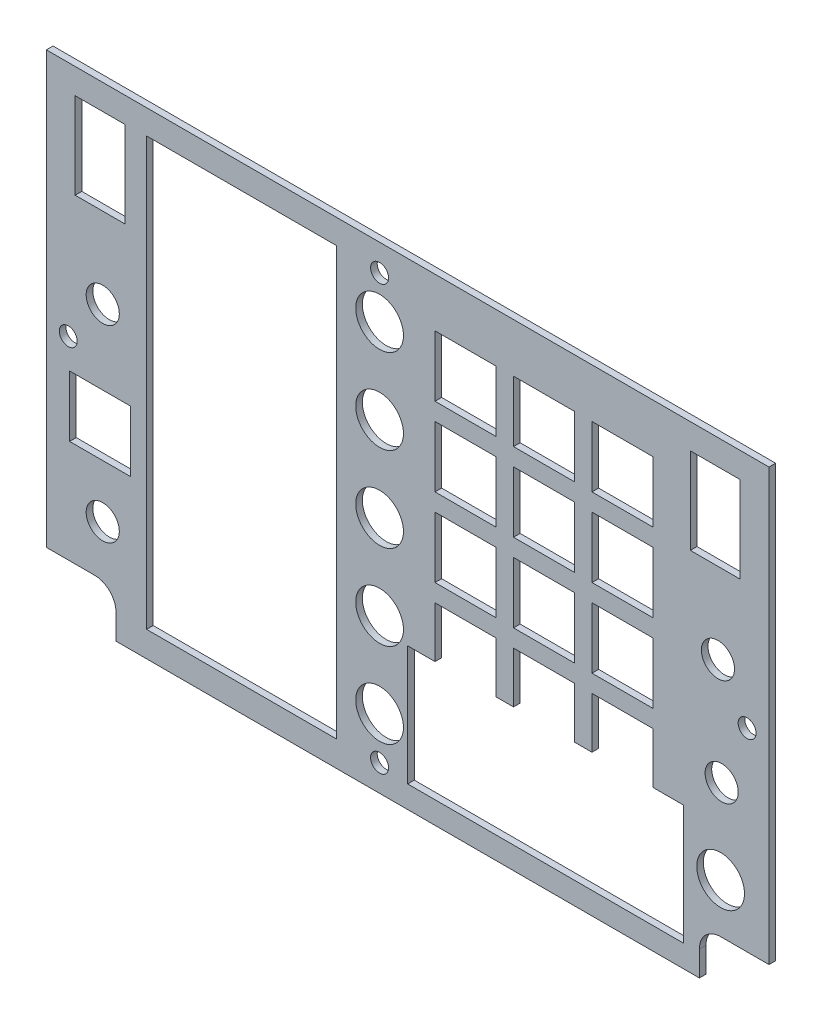
from build123d import *

# Parameters (mm, degrees)
BOSS_EXTRUDE1_DEPTH   = 1.5875
SKETCH3_R             = 4.445
SKETCH3_W             = 12.065
SKETCH3_H             = 12.065
CUT_EXTRUDE1_DEPTH    = 202.731272774
SKETCH4_R             = 3.96875
CUT_EXTRUDE2_DEPTH    = 202.731272774
SKETCH5_W             = 11.94
SKETCH5_H             = 20.64
SKETCH5_W_2           = 45.462
SKETCH5_H_2           = 102.32
SKETCH5_W_3           = 57
SKETCH5_H_3           = 15.1
CUT_EXTRUDE3_DEPTH    = 202.731272774
SKETCH6_R             = 5.715
SKETCH6_W             = 14.605
SKETCH6_H             = 14.605
CUT_EXTRUDE4_DEPTH    = 202.731272774
SKETCH7_W             = 66.04
SKETCH7_H             = 28.64
CUT_EXTRUDE5_DEPTH    = 202.731272774
F_6_CLEARANCE_HOLE2_D = 4.3053


with BuildPart() as part:
    # Sketch1 → Boss-Extrude1 (new body)
    with BuildSketch(Plane.XY):
        with BuildLine():
            Line((74.93, -171.1167297), (86.51875, -171.1167297))
            Line((86.51875, -171.1167297), (86.51875, -67.9292297))
            Line((86.51875, -67.9292297), (-86.51875, -67.9292297))
            Line((-86.51875, -67.9292297), (-86.51875, -171.1167297))
            Line((-86.51875, -171.1167297), (-74.93, -171.1167297))
            ThreePointArc((-74.93, -171.1167297), (-71.337897552, -172.604627251), (-69.85, -176.1967297))
            Line((-69.85, -176.1967297), (-69.85, -182.2292297))
            Line((-69.85, -182.2292297), (69.85, -182.2292297))
            Line((69.85, -182.2292297), (69.85, -176.1967297))
            ThreePointArc((69.85, -176.1967297), (71.337897552, -172.604627251), (74.93, -171.1167297))
        make_face()
    extrude(amount=-BOSS_EXTRUDE1_DEPTH)

    # Sketch3 → Cut-Extrude1 (cut, through all)
    with BuildSketch(Plane.XY):
        with Locations((74.93, -159.3692297)):
            Circle(SKETCH3_R)
        with Locations((-6.731, -165.7192297)):
            Circle(SKETCH3_R)
        with Locations((-6.731, -145.3992297)):
            Circle(SKETCH3_R)
        with Locations((-6.731, -125.0792297)):
            Circle(SKETCH3_R)
        with Locations((-6.731, -104.7592297)):
            Circle(SKETCH3_R)
        with Locations((-6.731, -84.4392297)):
            Circle(SKETCH3_R)
        with Locations((-73.66, -139.0492297)):
            Rectangle(SKETCH3_W, SKETCH3_H)
        with Locations((13.843, -143.3672297)):
            Rectangle(SKETCH3_W, SKETCH3_H)
        with Locations((32.639, -143.3672297)):
            Rectangle(SKETCH3_W, SKETCH3_H)
        with Locations((51.435, -143.3672297)):
            Rectangle(SKETCH3_W, SKETCH3_H)
        with Locations((51.435, -124.5712297)):
            Rectangle(SKETCH3_W, SKETCH3_H)
        with Locations((32.639, -124.5712297)):
            Rectangle(SKETCH3_W, SKETCH3_H)
        with Locations((13.843, -124.5712297)):
            Rectangle(SKETCH3_W, SKETCH3_H)
        with Locations((13.843, -105.7752297)):
            Rectangle(SKETCH3_W, SKETCH3_H)
        with Locations((13.843, -86.9792297)):
            Rectangle(SKETCH3_W, SKETCH3_H)
        with Locations((32.639, -86.9792297)):
            Rectangle(SKETCH3_W, SKETCH3_H)
        with Locations((32.639, -105.7752297)):
            Rectangle(SKETCH3_W, SKETCH3_H)
        with Locations((51.435, -105.7752297)):
            Rectangle(SKETCH3_W, SKETCH3_H)
        with Locations((51.435, -86.9792297)):
            Rectangle(SKETCH3_W, SKETCH3_H)
    extrude(amount=-CUT_EXTRUDE1_DEPTH, mode=Mode.SUBTRACT)

    # Sketch4 → Cut-Extrude2 (cut, through all)
    with BuildSketch(Plane.XY):
        with Locations((-73.025, -113.9667297)):
            Circle(SKETCH4_R)
        with Locations((-73.025, -159.0517297)):
            Circle(SKETCH4_R)
        with Locations((74.295, -113.9667297)):
            Circle(SKETCH4_R)
        with Locations((75.184, -139.0492297)):
            Circle(SKETCH4_R)
    extrude(amount=-CUT_EXTRUDE2_DEPTH, mode=Mode.SUBTRACT)

    # Sketch5 → Cut-Extrude3 (cut, through all)
    with BuildSketch(Plane.XY):
        with Locations((-73.66, -84.3122297)):
            Rectangle(SKETCH5_W, SKETCH5_H)
        with Locations((73.66, -84.3122297)):
            Rectangle(SKETCH5_W, SKETCH5_H)
        with Locations((-39.799, -124.9522297)):
            Rectangle(SKETCH5_W_2, SKETCH5_H_2)
        with Locations((33.02, -165.4922297)):
            Rectangle(SKETCH5_W_3, SKETCH5_H_3)
    extrude(amount=-CUT_EXTRUDE3_DEPTH, mode=Mode.SUBTRACT)

    # Sketch6 → Cut-Extrude4 (cut, through all)
    with BuildSketch(Plane.XY):
        with Locations((74.93, -159.3692297)):
            Circle(SKETCH6_R)
        with Locations((-6.731, -165.7192297)):
            Circle(SKETCH6_R)
        with Locations((-6.731, -145.3992297)):
            Circle(SKETCH6_R)
        with Locations((-6.731, -125.0792297)):
            Circle(SKETCH6_R)
        with Locations((-6.731, -104.7592297)):
            Circle(SKETCH6_R)
        with Locations((-6.731, -84.4392297)):
            Circle(SKETCH6_R)
        with Locations((51.435, -143.3672297)):
            Rectangle(SKETCH6_W, SKETCH6_H)
        with Locations((51.435, -124.5712297)):
            Rectangle(SKETCH6_W, SKETCH6_H)
        with Locations((51.435, -105.7752297)):
            Rectangle(SKETCH6_W, SKETCH6_H)
        with Locations((51.435, -86.9792297)):
            Rectangle(SKETCH6_W, SKETCH6_H)
        with Locations((32.639, -143.3672297)):
            Rectangle(SKETCH6_W, SKETCH6_H)
        with Locations((32.639, -124.5712297)):
            Rectangle(SKETCH6_W, SKETCH6_H)
        with Locations((32.639, -105.7752297)):
            Rectangle(SKETCH6_W, SKETCH6_H)
        with Locations((32.639, -86.9792297)):
            Rectangle(SKETCH6_W, SKETCH6_H)
        with Locations((13.843, -86.9792297)):
            Rectangle(SKETCH6_W, SKETCH6_H)
        with Locations((13.843, -105.7752297)):
            Rectangle(SKETCH6_W, SKETCH6_H)
        with Locations((13.843, -124.5712297)):
            Rectangle(SKETCH6_W, SKETCH6_H)
        with Locations((13.843, -143.3672297)):
            Rectangle(SKETCH6_W, SKETCH6_H)
        with Locations((-73.66, -139.0492297)):
            Rectangle(SKETCH6_W, SKETCH6_H)
    extrude(amount=-CUT_EXTRUDE4_DEPTH, mode=Mode.SUBTRACT)

    # Sketch7 → Cut-Extrude5 (cut, through all)
    with BuildSketch(Plane.XY):
        with Locations((33.02, -162.5922297)):
            Rectangle(SKETCH7_W, SKETCH7_H)
    extrude(amount=-CUT_EXTRUDE5_DEPTH, mode=Mode.SUBTRACT)

    # #6 Clearance Hole2 (through all)
    with Locations(Plane(origin=(0, 0, 1.5875), x_dir=(-1, 0, 0), z_dir=(0, 0, 1))):
        with Locations((-81.28, 124.6982297), (6.731, 175.8792297), (81.28, 124.6982297), (6.731, 74.2792297)):
            Hole(F_6_CLEARANCE_HOLE2_D / 2)


solid = part.part
